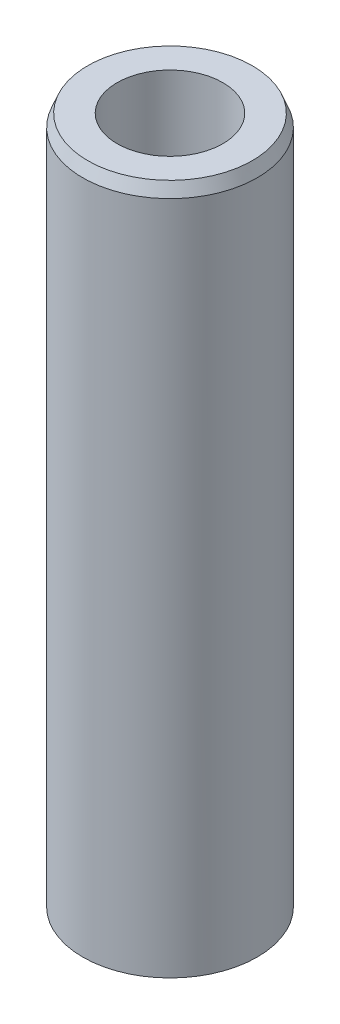
from build123d import *
from OCP.BRepFilletAPI import BRepFilletAPI_MakeChamfer

# Parameters (mm, degrees)
SKETCH1_R           = 7.5
BOSS_EXTRUDE1_DEPTH = 59.486597942
SKETCH2_R           = 4.546673796
CUT_EXTRUDE1_DEPTH  = 61.42479073
CHAMFER1_SIZE       = 1.06059063
CHAMFER1_SIZE2      = 0.427700921


with BuildPart() as part:
    # Sketch1 → Boss-Extrude1 (new body)
    with BuildSketch(Plane(origin=(0, 0, 0), x_dir=(1, 0, 0), z_dir=(0, 1, 0))):
        Circle(SKETCH1_R)
    extrude(amount=BOSS_EXTRUDE1_DEPTH)

    # Sketch2 → Cut-Extrude1 (cut, through all)
    with BuildSketch(Plane(origin=(0, 0, 0), x_dir=(1, 0, 0), z_dir=(0, 1, 0))):
        Circle(SKETCH2_R)
    extrude(amount=CUT_EXTRUDE1_DEPTH, mode=Mode.SUBTRACT)

    # Chamfer1: one chamfer whose edges measure the first distance from different faces: ONE call of the kernel's chamfer builder (chamfer() names one face for all edges)
    chamfer1_edges_1 = [part.edges().sort_by_distance(p)[0] for p in [
        (-7.5, 59.486597942, 0),
    ]]
    chamfer1_side_1 = [part.faces().sort_by_distance(p)[0] for p in [
        (-7.5, 29.743298971, 0),
    ]]
    chamfer1_edges_2 = [part.edges().sort_by_distance(p)[0] for p in [
        (-7.5, 0, 0),
    ]]
    chamfer1_side_2 = [part.faces().sort_by_distance(p)[0] for p in [
        (-7.287867966, 0, 0),
    ]]
    chamfer1 = BRepFilletAPI_MakeChamfer(part.part.solid().wrapped)
    for e in chamfer1_edges_1:
        chamfer1.Add(CHAMFER1_SIZE, CHAMFER1_SIZE2, e.wrapped, chamfer1_side_1[0].wrapped)  # the first distance lies on this face
    for e in chamfer1_edges_2:
        chamfer1.Add(CHAMFER1_SIZE, CHAMFER1_SIZE2, e.wrapped, chamfer1_side_2[0].wrapped)  # the first distance lies on this face
    add(Compound.cast(chamfer1.Shape()), mode=Mode.REPLACE)


solid = part.part
